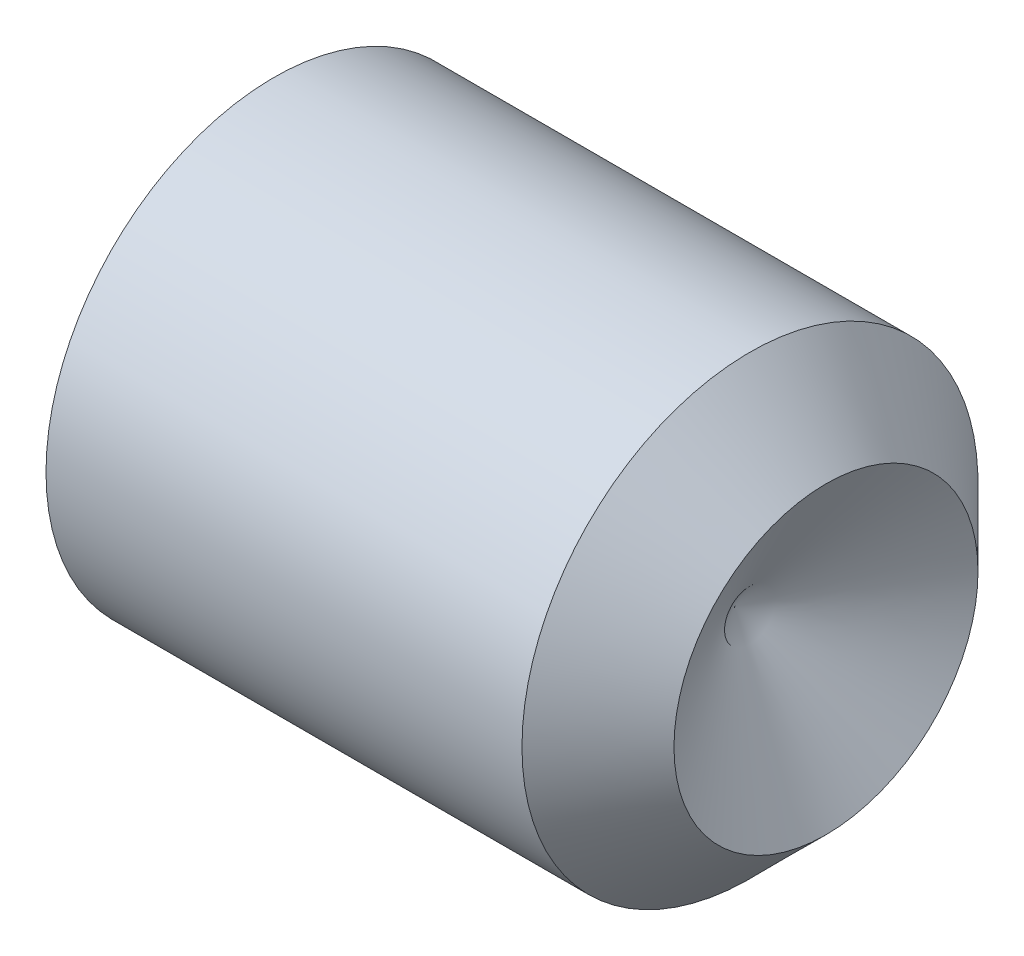
from build123d import *

# Parameters (mm, degrees)
SPLINE4_DEPTH     = 12
CIRPATTERN2_COUNT = 4


with BuildPart() as part:
    # BodySke → BaseBody (revolve)
    with BuildSketch(Plane.XY):
        Polygon((0, 0), (0, 10.352), (0.951473244, 12), (26, 12), (30, 8), (25.193115048, 0), align=None)
    revolve(axis=Axis((-12.7, 0, 0), (1, 0, 0)))

    # Sketch5 → Spline4 (cut)
    with BuildSketch(Plane(origin=(0, 1.522651774, 6.19807627), x_dir=(0, 0, 1), z_dir=(-1, 0, 0))):
        with BuildLine():
            Line((-6.19807627, -1.522651774), (1.47292373, -1.522651774))
            ThreePointArc((1.47292373, -1.522651774), (1.179556745, 0.578484134), (0.321894632, 2.51890986))
            Line((0.321894632, 2.51890986), (-0.387779849, 1.809235379))
            Line((-0.387779849, 1.809235379), (-2.866189117, 4.287644647))
            Line((-2.866189117, 4.287644647), (-2.156514636, 4.997319128))
            ThreePointArc((-2.156514636, 4.997319128), (-4.096940361, 5.85498124), (-6.19807627, 6.148348226))
            Line((-6.19807627, 6.148348226), (-6.19807627, -1.522651774))
        make_face()
    spline4 = extrude(amount=-SPLINE4_DEPTH, mode=Mode.SUBTRACT)

    # CirPattern2: Spline4 ×4 about axis
    cirpattern2_axis = Axis((-12.7, 0, 0), (1, 0, 0))
    for i in range(1, CIRPATTERN2_COUNT):
        add(spline4.rotate(cirpattern2_axis, i * 360 / CIRPATTERN2_COUNT), mode=Mode.SUBTRACT)


solid = part.part
